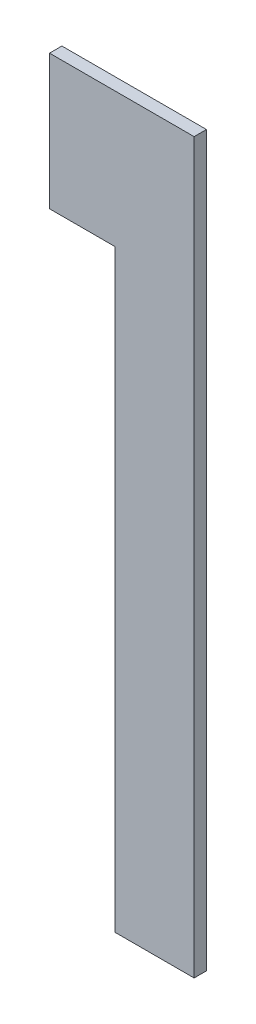
from build123d import *

# Parameters (mm, degrees)
BASE_FLANGE1_DEPTH = 1.17


# Sheet-metal steps are written as plain solids
with BuildPart() as part:
    # Sketch1 → Base-Flange1 (new body)
    with BuildSketch(Plane.XY):
        Polygon((0, 0), (7.5, 0), (7.5, 68.95), (-6.182584309, 68.95), (-6.182584309, 56.194477701), (0, 56.194477701), align=None)
    extrude(amount=-BASE_FLANGE1_DEPTH)


solid = part.part
